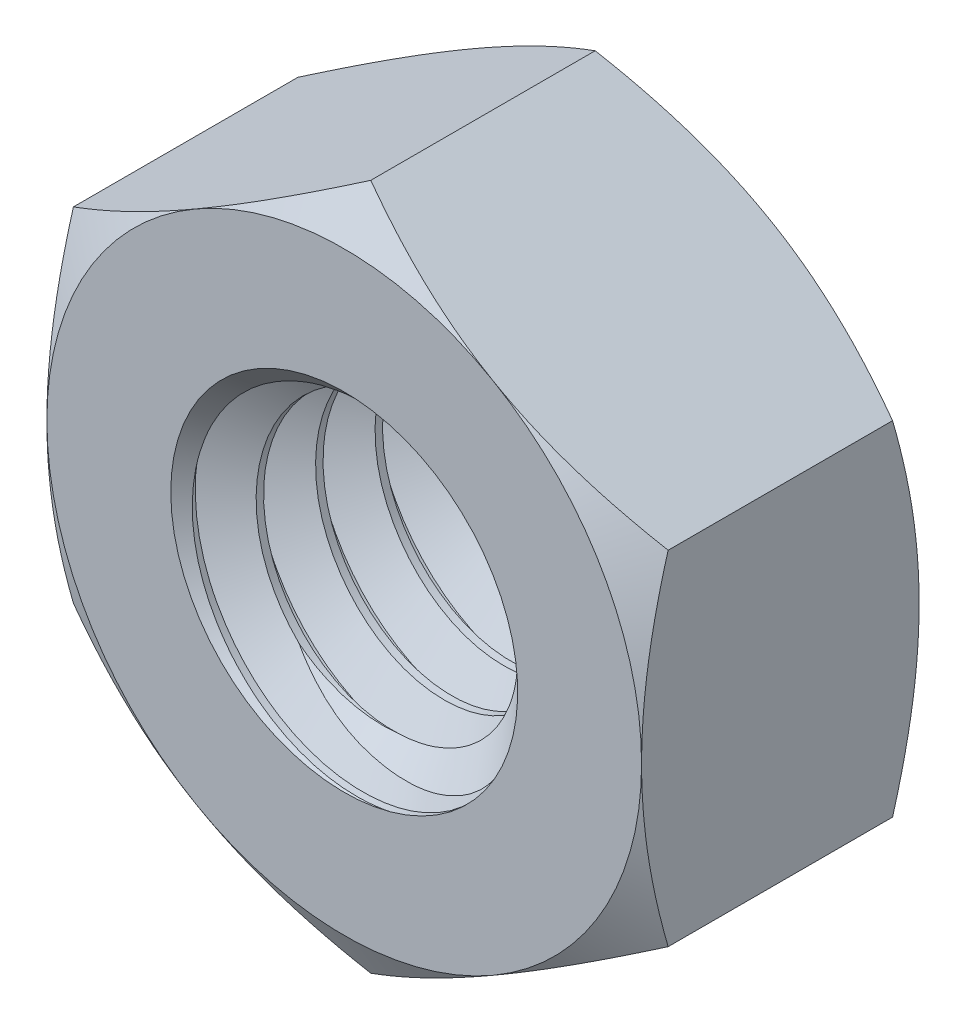
from build123d import *

# Parameters (mm, degrees)
EXTRUDE1_DEPTH          = 1.4
SKETCH13_R              = 1.75
BOSS_EXTRUDE1_DEPTH     = 2.8
CUT_SWEEP1_PITCH        = 0.6
SKETCH7_OUTSIDE_W       = 97.904
SKETCH7_OUTSIDE_H       = 98.832
SKETCH7_OUTSIDE_R       = 3
EXTRUDE2_DEPTH          = 25.4
EXTRUDE2_DRAFT          = -60
MIRROR2_COPY_1_SKETCH_W = 97.904
MIRROR2_COPY_1_SKETCH_H = 98.832
MIRROR2_COPY_1_SKETCH_R = 3
MIRROR2_COPY_1_DEPTH    = 25.4
MIRROR2_COPY_1_DRAFT    = -60


with BuildPart() as part:
    # Sketch1 → Extrude1 (new, symmetric)
    with BuildSketch(Plane.XY):
        Polygon((-3, 1.732050808), (-3, -1.732050808), (0, -3.464101615), (3, -1.732050808), (3, 1.732050808), (0, 3.464101615), align=None)
    extrude(amount=EXTRUDE1_DEPTH, both=True)

    # Cut-Extrude2 cone 1 section (through the dimple's axis) → Cut-Extrude2 (revolve, cut)
    with BuildSketch(Plane(origin=(0, 0, 1.4), x_dir=(0, -1, 0), z_dir=(1, 0, 0))):
        Polygon((0, 0), (1.75, 0), (0, 1.75), align=None)
    revolve(axis=Axis((0, 0, 1.4), (0, 0, -1)), mode=Mode.SUBTRACT)

    # Cut-Extrude3 cone 1 section (through the dimple's axis) → Cut-Extrude3 (revolve, cut)
    with BuildSketch(Plane(origin=(0, 0, -1.4), x_dir=(0, 1, 0), z_dir=(1, 0, 0))):
        Polygon((0, 0), (1.75, 0), (0, 1.75), align=None)
    revolve(axis=Axis((0, 0, -1.4), (0, 0, 1)), mode=Mode.SUBTRACT)


with BuildPart() as body_2:
    # Sketch13 → Boss-Extrude1 (new body)
    with BuildSketch(Plane(origin=(0, 0, -1.4), x_dir=(-1, 0, 0), z_dir=(0, 0, -1))):
        Circle(SKETCH13_R)
    extrude(amount=-BOSS_EXTRUDE1_DEPTH)

    # Cut-Sweep1: arcs per turn and ends read off the stored shape
    # Cut-Sweep1: the profile of Sketch12 profile screwed along a right-hand helix through 6.666667 turns, 6 arcs to a turn; built about Z, then put on its axis
    cut_sweep1_z = Axis((0, 0, 0), (0, 0, 1))
    cut_sweep1_corners = [(1.7503, 0, -1.125173205), (1.7503, 0, -0.599826795), (1.360288568, 0, -0.825), (1.360288568, 0, -0.9)]
    with BuildLine(mode=Mode.PRIVATE) as cut_sweep1_profile:
        Line(cut_sweep1_corners[0], cut_sweep1_corners[1])
        Line(cut_sweep1_corners[1], cut_sweep1_corners[2])
        Line(cut_sweep1_corners[2], cut_sweep1_corners[3])
        Line(cut_sweep1_corners[3], cut_sweep1_corners[0])
    cut_sweep1_cap = Face(cut_sweep1_profile.wire())
    cut_sweep1_turn_angles = [0, 30, 60, 90, 120, 150, 180, 210, 240, 270, 300, 330, 360]
    cut_sweep1_turn_weights = [1, 0.8660254037844387, 1, 0.8660254037844387, 1, 0.8660254037844387, 1, 0.8660254037844387, 1, 0.8660254037844387, 1, 0.8660254037844387, 1]
    cut_sweep1_turn_rails = [Edge.make_bspline([Vector(p[0], p[1], 0).rotate(cut_sweep1_z, cut_sweep1_turn_angles[k]) / cut_sweep1_turn_weights[k] + Vector(0, 0, p[2] + CUT_SWEEP1_PITCH * cut_sweep1_turn_angles[k] / 360) for k in range(13)], [0, 0, 0, 1, 1, 2, 2, 3, 3, 4, 4, 5, 5, 6, 6, 6], 2, cut_sweep1_turn_weights) for p in cut_sweep1_corners]
    cut_sweep1_turn_sides = [Face.make_surface_from_curves(cut_sweep1_turn_rails[p[0]], cut_sweep1_turn_rails[p[1]]) for p in [(0, 1), (1, 2), (2, 3), (3, 0)]]
    cut_sweep1_last_angles = [2160, 2190, 2220, 2250, 2280, 2310, 2340, 2370, 2400]
    cut_sweep1_last_weights = [1, 0.8660254037844387, 1, 0.8660254037844387, 1, 0.8660254037844387, 1, 0.8660254037844387, 1]
    cut_sweep1_last_rails = [Edge.make_bspline([Vector(p[0], p[1], 0).rotate(cut_sweep1_z, cut_sweep1_last_angles[k]) / cut_sweep1_last_weights[k] + Vector(0, 0, p[2] + CUT_SWEEP1_PITCH * cut_sweep1_last_angles[k] / 360) for k in range(9)], [0, 0, 0, 1, 1, 2, 2, 3, 3, 4, 4, 4], 2, cut_sweep1_last_weights) for p in cut_sweep1_corners]
    cut_sweep1_last_sides = [Face.make_surface_from_curves(cut_sweep1_last_rails[p[0]], cut_sweep1_last_rails[p[1]]) for p in [(0, 1), (1, 2), (2, 3), (3, 0)]]
    cut_sweep1 = Plane(origin=(0, 0, -1.4), x_dir=(0, 1, 0), z_dir=(0, 0, 1)) * Solid(Shell([*[p.moved(Location((0, 0, CUT_SWEEP1_PITCH * i))) for i in range(6) for p in cut_sweep1_turn_sides], *cut_sweep1_last_sides, cut_sweep1_cap, cut_sweep1_cap.rotate(cut_sweep1_z, 2400).moved(Location((0, 0, CUT_SWEEP1_PITCH * 2400 / 360)))]))
    add(cut_sweep1, mode=Mode.SUBTRACT)


with BuildPart() as part_1:
    add(part.part)

    # Combine1: cut body 2
    add(body_2.part, mode=Mode.SUBTRACT)


with BuildPart() as extrude2_tool:
    # Sketch7 outside → Extrude2 (with draft: the straight prism first)
    with BuildSketch(Plane.XY.offset(1.4)):
        Rectangle(SKETCH7_OUTSIDE_W, SKETCH7_OUTSIDE_H)
        Circle(SKETCH7_OUTSIDE_R, mode=Mode.SUBTRACT)
    extrude(amount=-EXTRUDE2_DEPTH)
    # Extrude2: the draft: its side faces are tilted about the plane it starts from
    extrude2_sides = [extrude2_tool.faces().sort_by_distance(p)[0] for p in [
        (0, -49.416, -11.3),
        (48.952, 0, -11.3),
        (0, 49.416, -11.3),
        (-48.952, 0, -11.3),
        (-3, 0, -11.3),
    ]]
    draft(extrude2_sides, Plane.XY.offset(1.4), EXTRUDE2_DRAFT)


with BuildPart() as part_2:
    add(part_1.part)

    # Extrude2: cut by extrude2_tool
    add(extrude2_tool.part, mode=Mode.SUBTRACT)


with BuildPart() as mirror2_copy_1_tool:
    # Mirror2 copy 1 sketch → Mirror2 copy 1 (with draft: the straight prism first)
    with BuildSketch(Plane(origin=(0, 0, -1.4), x_dir=(1, 0, 0), z_dir=(0, 0, -1))):
        Rectangle(MIRROR2_COPY_1_SKETCH_W, MIRROR2_COPY_1_SKETCH_H)
        Circle(MIRROR2_COPY_1_SKETCH_R, mode=Mode.SUBTRACT)
    extrude(amount=-MIRROR2_COPY_1_DEPTH)
    # Mirror2 copy 1: the draft: its side faces are tilted about the plane it starts from
    mirror2_copy_1_sides = [mirror2_copy_1_tool.faces().sort_by_distance(p)[0] for p in [
        (0, -49.416, 11.3),
        (48.952, 0, 11.3),
        (0, 49.416, 11.3),
        (-48.952, 0, 11.3),
        (-3, 0, 11.3),
    ]]
    draft(mirror2_copy_1_sides, Plane(origin=(0, 0, -1.4), x_dir=(1, 0, 0), z_dir=(0, 0, -1)), MIRROR2_COPY_1_DRAFT)


with BuildPart() as part_3:
    add(part_2.part)

    # Mirror2 copy 1: cut by mirror2_copy_1_tool
    add(mirror2_copy_1_tool.part, mode=Mode.SUBTRACT)


solid = part_3.part
